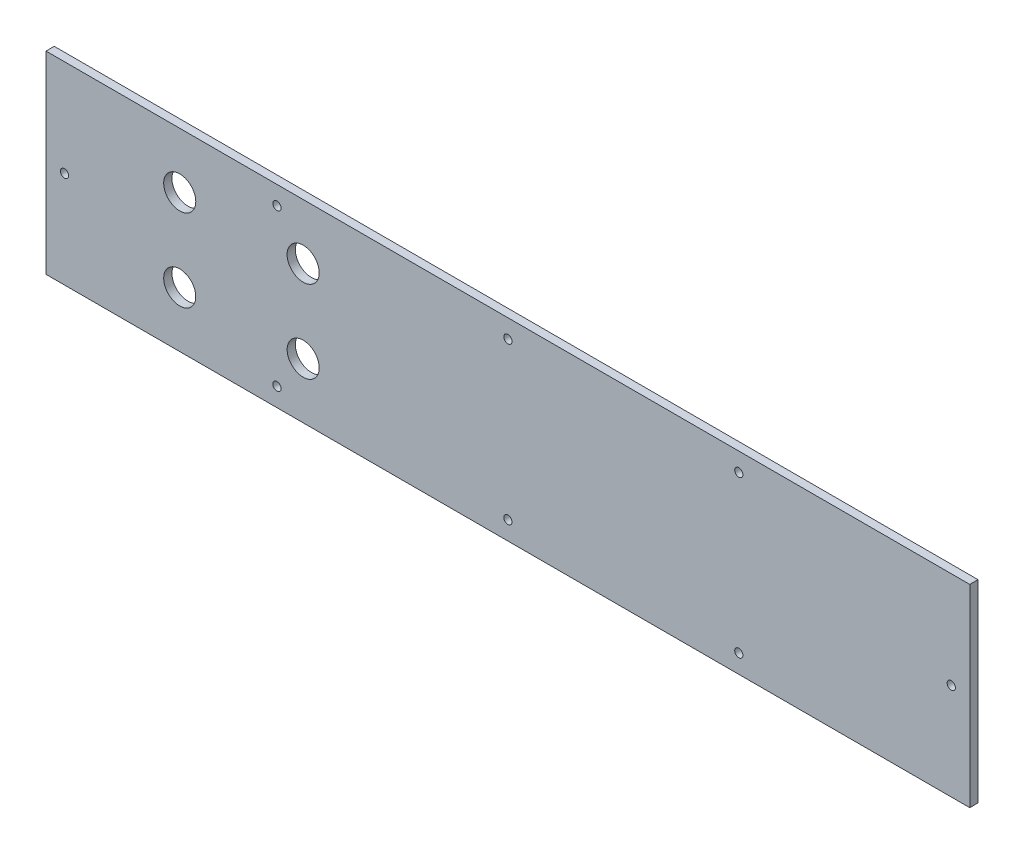
from build123d import *

# Parameters (mm, degrees)
SCHIZZO1_W                   = 449
SCHIZZO1_H                   = 94
SCHIZZO1_R                   = 7.8
SCHIZZO1_R_2                 = 2
ESTRUSIONE_ESTRUSIONE1_DEPTH = 4


with BuildPart() as part:
    # Schizzo1 → Estrusione-Estrusione1 (new body)
    with BuildSketch(Plane.XY):
        with Locations((-224.5, 47)):
            Rectangle(SCHIZZO1_W, SCHIZZO1_H)
        with Locations((-384, 27)):
            Circle(SCHIZZO1_R, mode=Mode.SUBTRACT)
        with Locations((-9, 47)):
            Circle(SCHIZZO1_R_2, mode=Mode.SUBTRACT)
        with Locations((-224.5, 85)):
            Circle(SCHIZZO1_R_2, mode=Mode.SUBTRACT)
        with Locations((-440, 47)):
            Circle(SCHIZZO1_R_2, mode=Mode.SUBTRACT)
        with Locations((-224.5, 9)):
            Circle(SCHIZZO1_R_2, mode=Mode.SUBTRACT)
        with Locations((-324, 27)):
            Circle(SCHIZZO1_R, mode=Mode.SUBTRACT)
        with Locations((-324, 67)):
            Circle(SCHIZZO1_R, mode=Mode.SUBTRACT)
        with Locations((-336.75, 85)):
            Circle(SCHIZZO1_R_2, mode=Mode.SUBTRACT)
        with Locations((-384, 67)):
            Circle(SCHIZZO1_R, mode=Mode.SUBTRACT)
        with Locations((-336.75, 9)):
            Circle(SCHIZZO1_R_2, mode=Mode.SUBTRACT)
        with Locations((-112.25, 9)):
            Circle(SCHIZZO1_R_2, mode=Mode.SUBTRACT)
        with Locations((-112.25, 85)):
            Circle(SCHIZZO1_R_2, mode=Mode.SUBTRACT)
    extrude(amount=ESTRUSIONE_ESTRUSIONE1_DEPTH)


solid = part.part
